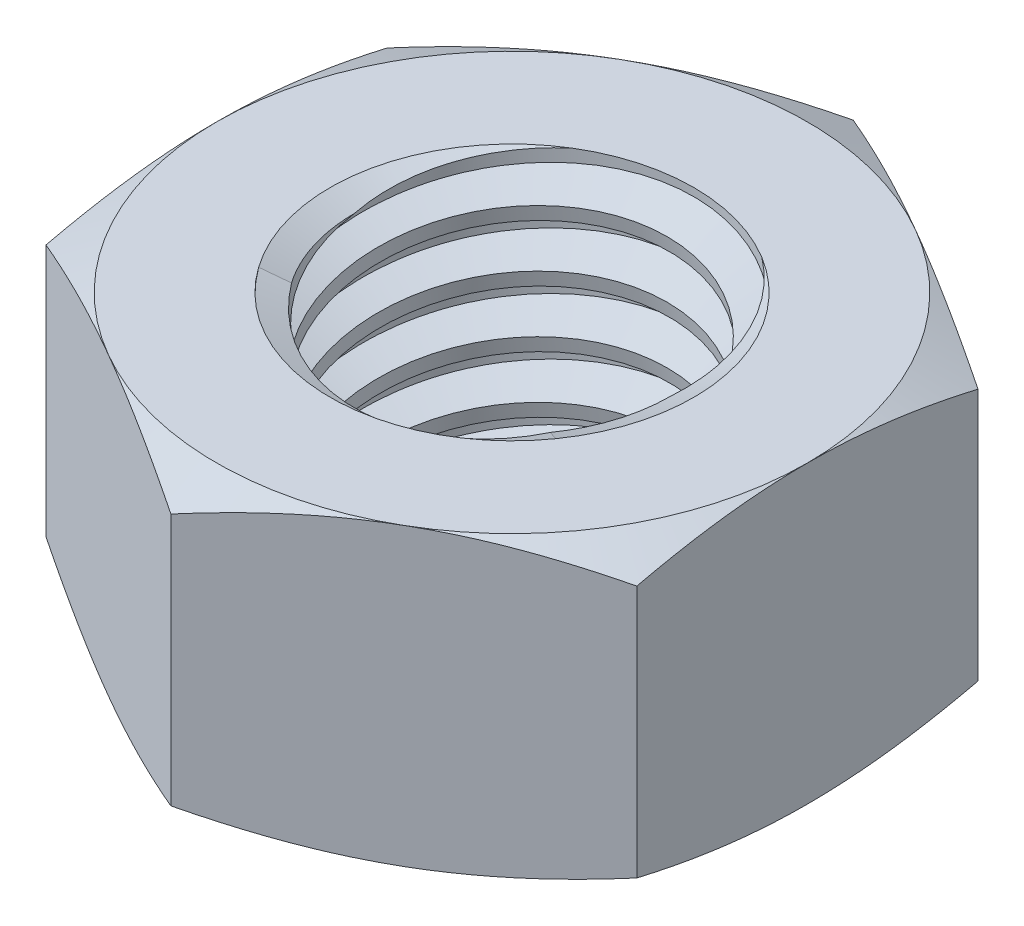
from build123d import *

# Parameters (mm, degrees)
EXTRUDE1_DEPTH       = 3.25
SKETCH2_W            = 4
SKETCH2_H            = 6.5
LPATTERN1_COUNT      = 5
LPATTERN1_PITCH      = 1.25
LPATTERN1_COUNT_DIR2 = 2
LPATTERN1_PITCH_DIR2 = 1.25


with BuildPart() as part:
    # Sketch1 → Extrude1 (new, symmetric)
    with BuildSketch(Plane(origin=(0, 0, 0), x_dir=(1, 0, 0), z_dir=(0, 1, 0))):
        Polygon((0, 7.505553499), (-6.5, 3.75277675), (-6.5, -3.75277675), (0, -7.505553499), (6.5, -3.75277675), (6.5, 3.75277675), align=None)
    extrude(amount=EXTRUDE1_DEPTH, both=True)

    # Sketch4 → Cut-Revolve2 (revolve, cut)
    with BuildSketch(Plane(origin=(0, 0, 0), x_dir=(0, 0, -1), z_dir=(1, 0, 0))):
        Polygon((0, 3.25), (4, 3.25), (3.415953356, 2.977654577), (3.415953356, -2.977654577), (4, -3.25), (0, -3.25), align=None)
    revolve(axis=Axis((0, 3.25, 0), (0, 1, 0)), mode=Mode.SUBTRACT)


with BuildPart() as body_2:
    # Sketch2 → Revolve1 (revolve)
    with BuildSketch(Plane(origin=(0, 0, 0), x_dir=(0, 0, -1), z_dir=(1, 0, 0))):
        with Locations((2, 0)):
            Rectangle(SKETCH2_W, SKETCH2_H)
    revolve(axis=Axis((0, -7.25, 0), (0, 1, 0)))

    # Sketch3 → Cut-Revolve1 (revolve, cut)
    with BuildSketch(Plane(origin=(0, 0, 0), x_dir=(0, 0, -1), z_dir=(1, 0, 0))):
        Polygon((4.024121388, 3.09562312), (4.1929711, 2.014984958), (3.464196131, 2.296478487), (3.415953356, 2.605232247), align=None)
    cut_revolve1 = revolve(axis=Axis((0, 3.25, 0.208852549), (0, -0.9880120337511015, -0.15437688027360985)), mode=Mode.SUBTRACT)

    # LPattern1: Cut-Revolve1 5 × 2
    with Locations(*[Vector(0, -1, 0) * (i * LPATTERN1_PITCH) + Vector(0, 1, 0) * (j * LPATTERN1_PITCH_DIR2) for i in range(LPATTERN1_COUNT) for j in range(LPATTERN1_COUNT_DIR2) if (i, j) != (0, 0)]):
        add(cut_revolve1, mode=Mode.SUBTRACT)


with BuildPart() as part_1:
    add(part.part)

    # Combine1: cut body 2
    add(body_2.part, mode=Mode.SUBTRACT)

    # Sketch5 → Cut-Revolve3 (revolve, cut)
    with BuildSketch(Plane(origin=(0, 0, 0), x_dir=(0, 0, -1), z_dir=(1, 0, 0))):
        Polygon((0, -3.25), (6.5, -3.25), (7.505553499, -2.781102703), (7.505553499, 2.781102703), (6.5, 3.25), (0, 3.25), (0, 4.52), (8.775553499, 4.52), (8.775553499, -4.52), (0, -4.52), align=None)
    revolve(axis=Axis((0, -3.25, 0), (0, 1, 0)), mode=Mode.SUBTRACT)


solid = part_1.part
